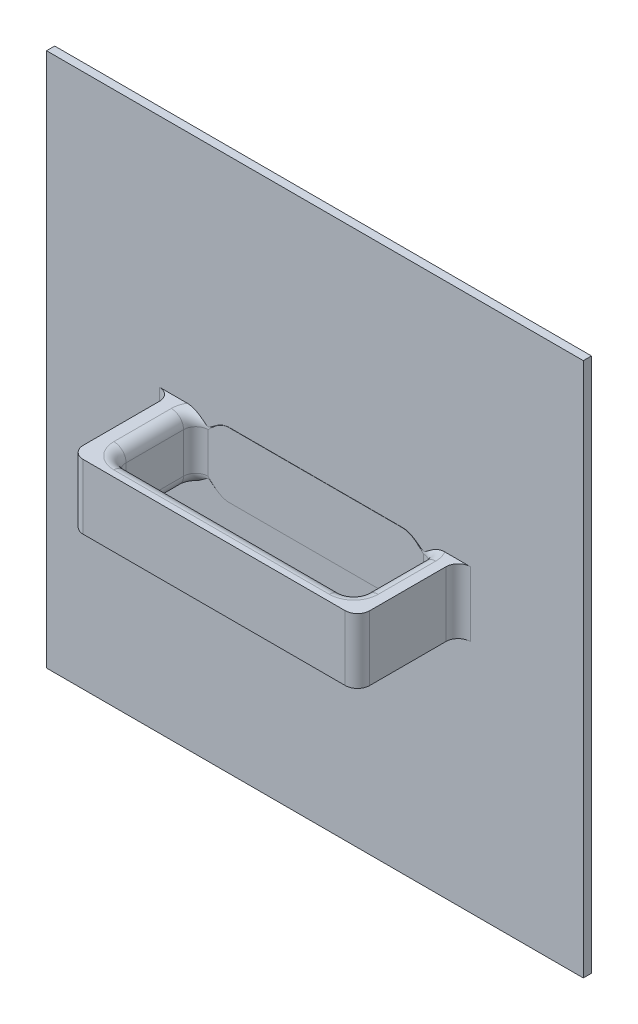
from build123d import *

# Parameters (mm, degrees)
SKETCH1_W           = 197.283851146
SKETCH1_H           = 196.506472468
BOSS_EXTRUDE1_DEPTH = 3
SKETCH2_W           = 105.294180986
SKETCH2_H           = 23.81812035
BOSS_EXTRUDE2_DEPTH = 37
SKETCH3_W           = 88.184047811
SKETCH3_H           = 30.124805729
CUT_EXTRUDE1_DEPTH  = 399.454465442
SKETCH4_W           = 177.283851146
SKETCH4_H           = 176.506472468
BOSS_EXTRUDE3_DEPTH = 3
FILLET1_R           = 4.5


with BuildPart() as part:
    # Sketch1 → Boss-Extrude1 (new body)
    with BuildSketch(Plane.XY.offset(333)):
        Rectangle(SKETCH1_W, SKETCH1_H)
    extrude(amount=-BOSS_EXTRUDE1_DEPTH)

    # Sketch2 → Boss-Extrude2 (add)
    with BuildSketch(Plane.XY.offset(333)):
        Rectangle(SKETCH2_W, SKETCH2_H)
    extrude(amount=BOSS_EXTRUDE2_DEPTH)

    # Sketch3 → Cut-Extrude1 (cut, through all)
    with BuildSketch(Plane(origin=(0, 11.909060175, 0), x_dir=(-1, 0, 0), z_dir=(0, 1, 0))):
        with Locations((-0.396924352, 348.147032921)):
            Rectangle(SKETCH3_W, SKETCH3_H)
    extrude(amount=-CUT_EXTRUDE1_DEPTH, mode=Mode.SUBTRACT)

    # Sketch4 → Boss-Extrude3 (add)
    with BuildSketch(Plane(origin=(0, 0, 330), x_dir=(-1, 0, 0), z_dir=(0, 0, -1))):
        Rectangle(SKETCH4_W, SKETCH4_H)
    extrude(amount=BOSS_EXTRUDE3_DEPTH)

    # Fillet1
    # the kernel refuses this fillet: 4.5 mm, written as the material it adds along each edge
    with BuildSketch(Plane(origin=(-52.647090493, -11.909060175, 333), x_dir=(-1, 0, 0), z_dir=(0, 1, 0)), Plane(origin=(52.647090493, 11.909060175, 333), x_dir=(1, 0, 0), z_dir=(0, -1, 0)), Plane(origin=(-43.695099554, 11.909060175, 333.084630056), x_dir=(1, 0, 0), z_dir=(0, -1, 0)), Plane(origin=(44.488948257, 11.909060175, 333.084630056), x_dir=(0, 0, 1), z_dir=(0, -1, 0)), Plane(origin=(44.488948257, 11.909060175, 363.209435785), x_dir=(-1, 0, 0), z_dir=(0, -1, 0))) as fillet1_piece_1:
        with BuildLine():
            CenterArc((FILLET1_R, FILLET1_R), FILLET1_R, 180, 90)
            Line((0, FILLET1_R), (0, 0))
            Line((0, 0), (FILLET1_R, 0))
        make_face()
    extrude(amount=23.818120349)
    with BuildSketch(Plane(origin=(-43.695099554, 11.909060175, 363.209435785), x_dir=(1, 0, 0), z_dir=(0, -1, 0))) as fillet1_piece_2:
        with BuildLine():
            CenterArc((FILLET1_R, -FILLET1_R), FILLET1_R, 90, 90)
            Line((0, -FILLET1_R), (0, 0))
            Line((0, 0), (FILLET1_R, 0))
        make_face()
    extrude(amount=23.818120349)
    # the kernel refuses this fillet: 4.5 mm, written as the material it takes off along each edge
    with BuildSketch(Plane(origin=(-52.647090493, -23.159060175, 370), x_dir=(0, 0, -1), z_dir=(0, 1, 0))) as fillet1_2_piece_1:
        with BuildLine():
            CenterArc((FILLET1_R, -FILLET1_R), FILLET1_R, 90, 90)
            Line((0, -FILLET1_R), (0, 0))
            Line((0, 0), (FILLET1_R, 0))
        make_face()
    extrude(amount=46.318120349, mode=Mode.SUBTRACT)
    with BuildSketch(Plane(origin=(52.647090493, 23.159060175, 370), x_dir=(-1, 0, 0), z_dir=(0, -1, 0))) as fillet1_2_piece_2:
        with BuildLine():
            CenterArc((FILLET1_R, FILLET1_R), FILLET1_R, 180, 90)
            Line((0, FILLET1_R), (0, 0))
            Line((0, 0), (FILLET1_R, 0))
        make_face()
    extrude(amount=46.318120349, mode=Mode.SUBTRACT)
    # the kernel refuses this fillet: 4.5 mm, written as the material it takes off along each edge
    with BuildSketch(Plane(origin=(39.988948257, -11.909060175, 363.209435785), x_dir=(0, 0, 1), z_dir=(-1, 0, 0)), Plane(origin=(-39.195099554, 11.909060175, 363.209435785), x_dir=(0, 0, 1), z_dir=(1, 0, 0))) as fillet1_3_piece_1:
        with BuildLine():
            CenterArc((FILLET1_R, FILLET1_R), FILLET1_R, 180, 90)
            Line((0, FILLET1_R), (0, 0))
            Line((0, 0), (FILLET1_R, 0))
        make_face()
    extrude(amount=79.184047811, mode=Mode.SUBTRACT)
    with BuildSketch(Plane(origin=(44.488948257, -11.909060175, 337.584630056), x_dir=(1, 0, 0), z_dir=(0, 0, 1)), Plane(origin=(-43.695099554, -11.909060175, 358.709435785), x_dir=(-1, 0, 0), z_dir=(0, 0, -1)), Plane(origin=(-43.695099554, 11.909060175, 337.584630056), x_dir=(-1, 0, 0), z_dir=(0, 0, 1)), Plane(origin=(44.488948257, 11.909060175, 358.709435785), x_dir=(1, 0, 0), z_dir=(0, 0, -1))) as fillet1_3_piece_2:
        with BuildLine():
            CenterArc((FILLET1_R, FILLET1_R), FILLET1_R, 180, 90)
            Line((0, FILLET1_R), (0, 0))
            Line((0, 0), (FILLET1_R, 0))
        make_face()
    extrude(amount=21.124805729, mode=Mode.SUBTRACT)
    with BuildSketch(Plane(origin=(39.988948257, 11.909060175, 358.709435785), x_dir=(0, 0, 1), z_dir=(-1, 0, 0))) as fillet1_3_piece_3:
        with BuildLine():
            CenterArc((4.5 + FILLET1_R, -FILLET1_R), FILLET1_R, 90, 90)
            Line((4.5, -FILLET1_R), (4.5, 0))
            Line((4.5, 0), (4.5 + FILLET1_R, 0))
        make_face()
    revolve(axis=Axis((39.988948257, 11.909060175, 358.709435785), (0, 1, 0)), revolution_arc=90, mode=Mode.SUBTRACT)
    with BuildSketch(Plane(origin=(39.988948257, 11.909060175, 337.584630056), x_dir=(1, 0, 0), z_dir=(0, 0, 1))) as fillet1_3_piece_4_section:
        with BuildLine():
            CenterArc((4.5 + FILLET1_R, -FILLET1_R), FILLET1_R, 90, 90)
            Line((4.5, -FILLET1_R), (4.5, 0))
            Line((4.5, 0), (4.5 + FILLET1_R, 0))
        make_face()
    fillet1_3_piece_4 = revolve(axis=Axis((39.988948257, 11.909060175, 337.584630056), (0, 1, 0)), revolution_arc=233.296989237, mode=Mode.PRIVATE)
    fillet1_3_piece_4 = split(fillet1_3_piece_4, bisect_by=Plane(origin=(44.493564863, 10.622272413, 333), z_dir=(0, 0, 1)), keep=Keep.TOP, mode=Mode.PRIVATE)
    add(fillet1_3_piece_4, mode=Mode.SUBTRACT)
    with BuildSketch(Plane(origin=(-39.195099554, 11.909060175, 358.709435785), x_dir=(0, 0, 1), z_dir=(1, 0, 0))) as fillet1_3_piece_5:
        with BuildLine():
            CenterArc((4.5 + FILLET1_R, FILLET1_R), FILLET1_R, 180, 90)
            Line((4.5, FILLET1_R), (4.5, 0))
            Line((4.5, 0), (4.5 + FILLET1_R, 0))
        make_face()
    revolve(axis=Axis((-39.195099554, 11.909060175, 358.709435785), (0, -1, 0)), revolution_arc=90, mode=Mode.SUBTRACT)
    with BuildSketch(Plane(origin=(-39.195099554, 11.909060175, 337.584630056), x_dir=(0.5976672776328248, 0, 0.8017442392976503), z_dir=(-0.8017442392976503, 0, 0.5976672776328248))) as fillet1_3_piece_6_section:
        with BuildLine():
            CenterArc((4.5 + FILLET1_R, -FILLET1_R), FILLET1_R, 90, 90)
            Line((4.5, -FILLET1_R), (4.5, 0))
            Line((4.5, 0), (4.5 + FILLET1_R, 0))
        make_face()
    fillet1_3_piece_6 = revolve(axis=Axis((-39.195099554, 11.909060175, 337.584630056), (0, 1, 0)), revolution_arc=233.296989237, mode=Mode.PRIVATE)
    fillet1_3_piece_6 = split(fillet1_3_piece_6, bisect_by=Plane(origin=(-31.617499549, 11.798389759, 333), z_dir=(0, 0, 1)), keep=Keep.TOP, mode=Mode.PRIVATE)
    add(fillet1_3_piece_6, mode=Mode.SUBTRACT)
    with BuildSketch(Plane(origin=(-39.195099554, -11.909060175, 358.709435785), x_dir=(0, 0, 1), z_dir=(1, 0, 0))) as fillet1_3_piece_7:
        with BuildLine():
            CenterArc((4.5 + FILLET1_R, -FILLET1_R), FILLET1_R, 90, 90)
            Line((4.5, -FILLET1_R), (4.5, 0))
            Line((4.5, 0), (4.5 + FILLET1_R, 0))
        make_face()
    revolve(axis=Axis((-39.195099554, -11.909060175, 358.709435785), (0, -1, 0)), revolution_arc=90, mode=Mode.SUBTRACT)
    with BuildSketch(Plane(origin=(-39.195099554, -11.909060175, 337.584630056), x_dir=(0.5976672776328248, 0, 0.8017442392976503), z_dir=(-0.8017442392976503, 0, 0.5976672776328248))) as fillet1_3_piece_8_section:
        with BuildLine():
            CenterArc((4.5 + FILLET1_R, FILLET1_R), FILLET1_R, 180, 90)
            Line((4.5, FILLET1_R), (4.5, 0))
            Line((4.5, 0), (4.5 + FILLET1_R, 0))
        make_face()
    fillet1_3_piece_8 = revolve(axis=Axis((-39.195099554, -11.909060175, 337.584630056), (0, 1, 0)), revolution_arc=233.296989237, mode=Mode.PRIVATE)
    fillet1_3_piece_8 = split(fillet1_3_piece_8, bisect_by=Plane(origin=(-31.617499549, -11.798389759, 333), z_dir=(0, 0, 1)), keep=Keep.TOP, mode=Mode.PRIVATE)
    add(fillet1_3_piece_8, mode=Mode.SUBTRACT)
    with BuildSketch(Plane(origin=(39.988948257, -11.909060175, 337.584630056), x_dir=(1, 0, 0), z_dir=(0, 0, 1))) as fillet1_3_piece_9_section:
        with BuildLine():
            CenterArc((4.5 + FILLET1_R, FILLET1_R), FILLET1_R, 180, 90)
            Line((4.5, FILLET1_R), (4.5, 0))
            Line((4.5, 0), (4.5 + FILLET1_R, 0))
        make_face()
    fillet1_3_piece_9 = revolve(axis=Axis((39.988948257, -11.909060175, 337.584630056), (0, 1, 0)), revolution_arc=233.296989237, mode=Mode.PRIVATE)
    fillet1_3_piece_9 = split(fillet1_3_piece_9, bisect_by=Plane(origin=(44.493564863, -10.622272413, 333), z_dir=(0, 0, 1)), keep=Keep.TOP, mode=Mode.PRIVATE)
    add(fillet1_3_piece_9, mode=Mode.SUBTRACT)
    with BuildSketch(Plane(origin=(39.988948257, -11.909060175, 358.709435785), x_dir=(0, 0, 1), z_dir=(-1, 0, 0))) as fillet1_3_piece_10:
        with BuildLine():
            CenterArc((4.5 + FILLET1_R, FILLET1_R), FILLET1_R, 180, 90)
            Line((4.5, FILLET1_R), (4.5, 0))
            Line((4.5, 0), (4.5 + FILLET1_R, 0))
        make_face()
    revolve(axis=Axis((39.988948257, -11.909060175, 358.709435785), (0, 1, 0)), revolution_arc=90, mode=Mode.SUBTRACT)


solid = part.part
